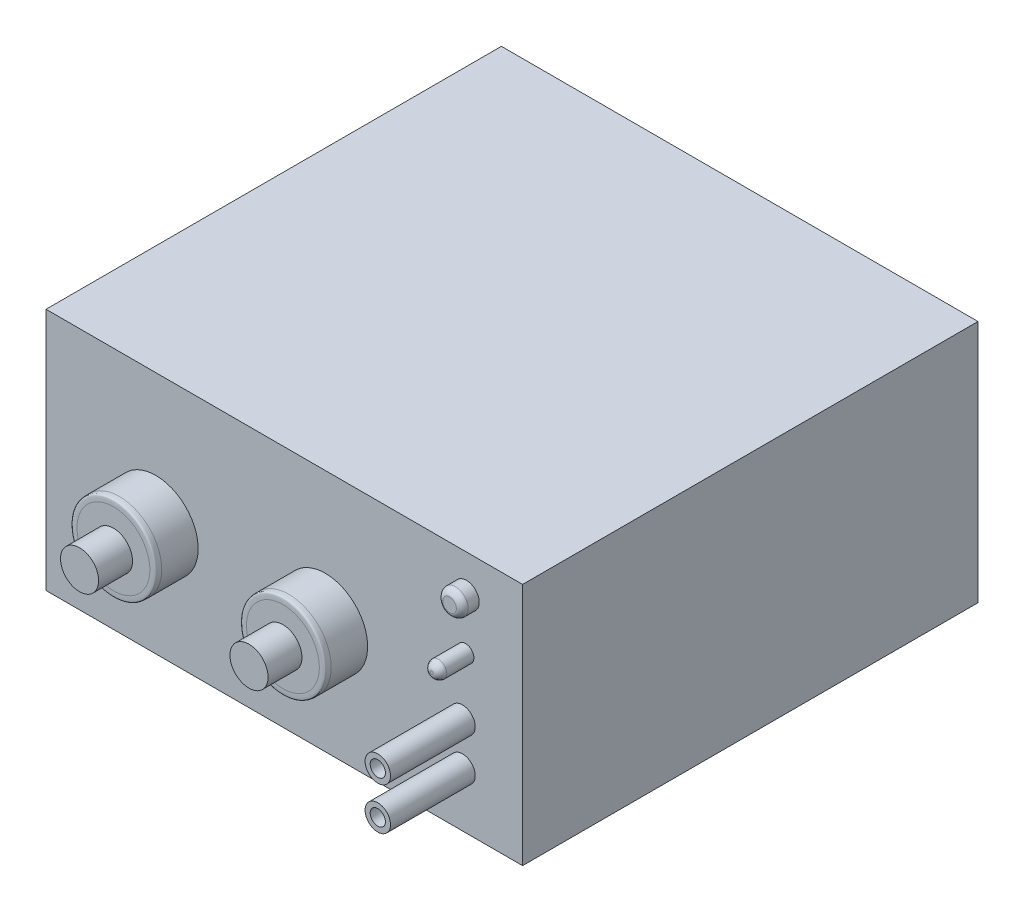
from build123d import *

# Parameters (mm, degrees)
SKETCH1_W           = 142.875
SKETCH1_H           = 136.525
BOSS_EXTRUDE1_DEPTH = 73.025
SKETCH2_R           = 12.7
BOSS_EXTRUDE2_DEPTH = 12.7
FILLET2_SIZE        = 1.778
SKETCH3_R           = 5.715
BOSS_EXTRUDE3_DEPTH = 22.86
LPATTERN1_COUNT     = 2
LPATTERN1_PITCH     = 50.8
FILLET3_SIZE        = 1.778
SKETCH5_R           = 5.715
BOSS_EXTRUDE4_DEPTH = 10.16
SKETCH6_R           = 3.81
BOSS_EXTRUDE5_DEPTH = 5.08
FILLET4_SIZE        = 1.778
SKETCH7_R           = 2.5
BOSS_EXTRUDE6_DEPTH = 10.16
FILLET5_SIZE        = 2.032
SKETCH9_R           = 3.81
BOSS_EXTRUDE7_DEPTH = 25.4
SKETCH10_R          = 2.286
CUT_EXTRUDE1_DEPTH  = 25.4
LPATTERN2_COUNT     = 2
LPATTERN2_PITCH     = 12.7
SKETCH11_R          = 2.286
CUT_EXTRUDE2_DEPTH  = 25.4


with BuildPart() as part:
    # Sketch1 → Boss-Extrude1 (new body)
    with BuildSketch(Plane(origin=(0, 0, 0), x_dir=(1, 0, 0), z_dir=(0, 1, 0))):
        Rectangle(SKETCH1_W, SKETCH1_H)
    extrude(amount=BOSS_EXTRUDE1_DEPTH)

    # Sketch2 → Boss-Extrude2 (add)
    with BuildSketch(Plane.XY.offset(68.2625)):
        with Locations(Location((-38.516675306, 33.650171928, 0), (0, 0, 180))):
            Circle(SKETCH2_R)
    boss_extrude2 = extrude(amount=BOSS_EXTRUDE2_DEPTH)

    # Fillet2
    # a fillet whose section is not a circle: 1.778 mm, written as the material it takes off along each edge
    with BuildSketch(Plane(origin=(-38.516675306, 33.650171928, 80.9625), x_dir=(-1, 0, 0), z_dir=(0, 1, 0))) as fillet2_piece_1:
        with BuildLine():
            Bezier((12.7, -FILLET2_SIZE), (12.7, 0), (12.7 - FILLET2_SIZE, 0), weights=[1, 4.949747468, 1])
            Line((12.7 - FILLET2_SIZE, 0), (12.7, 0))
            Line((12.7, 0), (12.7, -FILLET2_SIZE))
        make_face()
    revolve(axis=Axis((-38.516675306, 33.650171928, 80.9625), (0, 0, 1)), mode=Mode.SUBTRACT)

    # Sketch3 → Boss-Extrude3 (add)
    with BuildSketch(Plane.XY.offset(68.2625)):
        with Locations((-38.516675306, 33.290572788)):
            Circle(SKETCH3_R)
    extrude(amount=BOSS_EXTRUDE3_DEPTH)

    # LPattern1: Boss-Extrude2 ×2
    with Locations(*[(i * LPATTERN1_PITCH, 0, 0) for i in range(1, LPATTERN1_COUNT)]):
        add(boss_extrude2)

    # Fillet3
    # a fillet whose section is not a circle: 1.778 mm, written as the material it takes off along each edge
    with BuildSketch(Plane(origin=(12.283324694, 33.650171928, 80.9625), x_dir=(-1, 0, 0), z_dir=(0, 1, 0))) as fillet3_piece_1:
        with BuildLine():
            Bezier((12.7, -FILLET3_SIZE), (12.7, 0), (12.7 - FILLET3_SIZE, 0), weights=[1, 4.949747468, 1])
            Line((12.7 - FILLET3_SIZE, 0), (12.7, 0))
            Line((12.7, 0), (12.7, -FILLET3_SIZE))
        make_face()
    revolve(axis=Axis((12.283324694, 33.650171928, 80.9625), (0, 0, 1)), mode=Mode.SUBTRACT)

    # Sketch5 → Boss-Extrude4 (add)
    with BuildSketch(Plane.XY.offset(80.9625)):
        with Locations((12.283324694, 33.650171928)):
            Circle(SKETCH5_R)
    extrude(amount=BOSS_EXTRUDE4_DEPTH)

    # Sketch6 → Boss-Extrude5 (add)
    with BuildSketch(Plane.XY.offset(68.2625)):
        with Locations(Location((54.627573576, 61.857843882, 0), (0, 0, 180))):
            Circle(SKETCH6_R)
    extrude(amount=BOSS_EXTRUDE5_DEPTH)

    # Fillet4
    # a fillet whose section is not a circle: 1.778 mm, written as the material it takes off along each edge
    with BuildSketch(Plane(origin=(54.627573576, 61.857843882, 73.3425), x_dir=(-1, 0, 0), z_dir=(0, 1, 0))) as fillet4_piece_1:
        with BuildLine():
            Bezier((3.81, -FILLET4_SIZE), (3.81, 0), (3.81 - FILLET4_SIZE, 0), weights=[1, 0.449977043, 1])
            Line((3.81 - FILLET4_SIZE, 0), (3.81, 0))
            Line((3.81, 0), (3.81, -FILLET4_SIZE))
        make_face()
    revolve(axis=Axis((54.627573576, 61.857843882, 73.3425), (0, 0, 1)), mode=Mode.SUBTRACT)

    # Sketch7 → Boss-Extrude6 (add)
    with BuildSketch(Plane.XY.offset(68.2625)):
        with Locations(Location((54.338250319, 46.619193899, 0), (0, 0, 180))):
            Circle(SKETCH7_R)
    extrude(amount=BOSS_EXTRUDE6_DEPTH)

    # Fillet5
    # a fillet whose section is not a circle: 2.032 mm, written as the material it takes off along each edge
    with BuildSketch(Plane(origin=(54.338250319, 46.619193899, 78.4225), x_dir=(-1, 0, 0), z_dir=(0, 1, 0))) as fillet5_piece_1:
        with BuildLine():
            Bezier((2.5, -FILLET5_SIZE), (2.5, 0), (2.5 - FILLET5_SIZE, 0), weights=[1, 0.565685425, 1])
            Line((2.5 - FILLET5_SIZE, 0), (2.5, 0))
            Line((2.5, 0), (2.5, -FILLET5_SIZE))
        make_face()
    revolve(axis=Axis((54.338250319, 46.619193899, 78.4225), (0, 0, 1)), mode=Mode.SUBTRACT)

    # Sketch9 → Boss-Extrude7 (add)
    with BuildSketch(Plane.XY.offset(68.2625)):
        with Locations(Location((53.431620425, 28.929804746, 0), (0, 0, 180))):
            Circle(SKETCH9_R)
    boss_extrude7 = extrude(amount=BOSS_EXTRUDE7_DEPTH)

    # Sketch10 → Cut-Extrude1 (cut)
    with BuildSketch(Plane.XY.offset(93.6625)):
        with Locations((53.431620425, 28.929804746)):
            Circle(SKETCH10_R)
    extrude(amount=-CUT_EXTRUDE1_DEPTH, mode=Mode.SUBTRACT)

    # LPattern2: Boss-Extrude7 ×2
    with Locations(*[(0, -i * LPATTERN2_PITCH, 0) for i in range(1, LPATTERN2_COUNT)]):
        add(boss_extrude7)

    # Sketch11 → Cut-Extrude2 (cut)
    with BuildSketch(Plane.XY.offset(93.6625)):
        with Locations((53.431620425, 16.229804746)):
            Circle(SKETCH11_R)
    extrude(amount=-CUT_EXTRUDE2_DEPTH, mode=Mode.SUBTRACT)


solid = part.part
